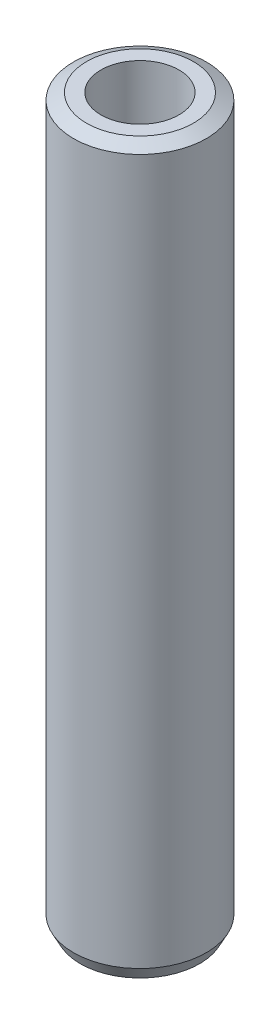
from build123d import *
from OCP.BRepFilletAPI import BRepFilletAPI_MakeChamfer

# Parameters (mm, degrees)
SKETCH1_R           = 55
BOSS_EXTRUDE1_DEPTH = 600
SKETCH2_R           = 32.293822609
CUT_EXTRUDE1_DEPTH  = 606.020660804
CHAMFER1_SIZE       = 5.625403432
CHAMFER1_SIZE2      = 10.768454585


with BuildPart() as part:
    # Sketch1 → Boss-Extrude1 (new body)
    with BuildSketch(Plane(origin=(0, 0, 0), x_dir=(1, 0, 0), z_dir=(0, 1, 0))):
        Circle(SKETCH1_R)
    extrude(amount=BOSS_EXTRUDE1_DEPTH)

    # Sketch2 → Cut-Extrude1 (cut, through all)
    with BuildSketch(Plane(origin=(0, 0, 0), x_dir=(1, 0, 0), z_dir=(0, 1, 0))):
        Circle(SKETCH2_R)
    extrude(amount=CUT_EXTRUDE1_DEPTH, mode=Mode.SUBTRACT)

    # Chamfer1: one chamfer whose edges measure the first distance from different faces: ONE call of the kernel's chamfer builder (chamfer() names one face for all edges)
    chamfer1_edges_1 = [part.edges().sort_by_distance(p)[0] for p in [
        (-55, 600, 0),
    ]]
    chamfer1_side_1 = [part.faces().sort_by_distance(p)[0] for p in [
        (-55, 300, 0),
    ]]
    chamfer1_edges_2 = [part.edges().sort_by_distance(p)[0] for p in [
        (-55, 0, 0),
    ]]
    chamfer1_side_2 = [part.faces().sort_by_distance(p)[0] for p in [
        (-53.444365081, 0, 0),
    ]]
    chamfer1 = BRepFilletAPI_MakeChamfer(part.part.solid().wrapped)
    for e in chamfer1_edges_1:
        chamfer1.Add(CHAMFER1_SIZE, CHAMFER1_SIZE2, e.wrapped, chamfer1_side_1[0].wrapped)  # the first distance lies on this face
    for e in chamfer1_edges_2:
        chamfer1.Add(CHAMFER1_SIZE, CHAMFER1_SIZE2, e.wrapped, chamfer1_side_2[0].wrapped)  # the first distance lies on this face
    add(Compound.cast(chamfer1.Shape()), mode=Mode.REPLACE)


solid = part.part
